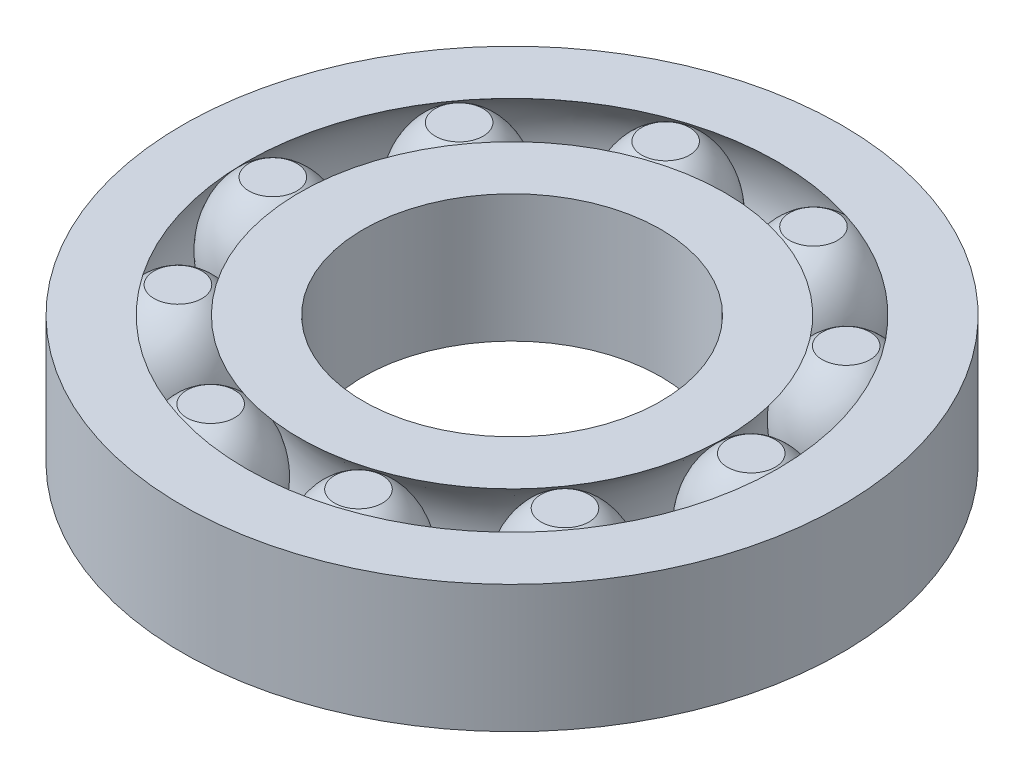
from build123d import *

# Parameters (mm, degrees)
CIRPATTERN7_COUNT = 10


with BuildPart() as part:
    # Sketch1 → Revolve1 (revolve)
    with BuildSketch(Plane.XY):
        with BuildLine():
            Line((-7, 3), (-10, 3))
            add(Edge.make_bspline(
                [(-10, -3), (-5.2, 0), (-10, 3)],
                knots=[3.613454491, 3.613454491, 3.613454491, 5.81132347, 5.81132347, 5.81132347], degree=2, weights=[1, 0.454545455, 1]))
            Line((-10, -3), (-7, -3))
            Line((-7, -3), (-7, 3))
        make_face()
        with BuildLine():
            Line((-15.5, -3), (-12.5, -3))
            add(Edge.make_bspline(
                [(-12.5, 3), (-17.3, 0), (-12.5, -3)],
                knots=[0.471861837, 0.471861837, 0.471861837, 2.669730816, 2.669730816, 2.669730816], degree=2, weights=[1, 0.454545455, 1]))
            Line((-12.5, 3), (-15.5, 3))
            Line((-15.5, 3), (-15.5, -3))
        make_face()
    revolve(axis=Axis((0, 0, 0), (0, 1, 0)))


with BuildPart() as body_2:
    # Sketch3 → Revolve2 (revolve)
    with BuildSketch(Plane.XY):
        with BuildLine():
            Line((-11.25, 3), (-11.25, -3))
            Line((-11.25, -3), (-10.125, -3))
            add(Edge.make_bspline(
                [(-10.125, -3), (-5.125, 0), (-10.125, 3)],
                knots=[3.584503698, 3.584503698, 3.584503698, 5.840274263, 5.840274263, 5.840274263], degree=2, weights=[1, 0.428571429, 1]))
            Line((-10.125, 3), (-11.25, 3))
        make_face()
    revolve(axis=Axis((-11.25, 3, 0), (0, -1, 0)))


with BuildPart() as cirpattern7_1:
    # CirPattern7: pattern copy
    add(body_2.part.rotate(Axis((0, 3, 0), (0, -1, 0)), 1 * 360 / CIRPATTERN7_COUNT))


with BuildPart() as cirpattern7_2:
    # CirPattern7: pattern copy
    add(body_2.part.rotate(Axis((0, 3, 0), (0, -1, 0)), 2 * 360 / CIRPATTERN7_COUNT))


with BuildPart() as cirpattern7_3:
    # CirPattern7: pattern copy
    add(body_2.part.rotate(Axis((0, 3, 0), (0, -1, 0)), 3 * 360 / CIRPATTERN7_COUNT))


with BuildPart() as cirpattern7_4:
    # CirPattern7: pattern copy
    add(body_2.part.rotate(Axis((0, 3, 0), (0, -1, 0)), 4 * 360 / CIRPATTERN7_COUNT))


with BuildPart() as cirpattern7_5:
    # CirPattern7: pattern copy
    add(body_2.part.rotate(Axis((0, 3, 0), (0, -1, 0)), 5 * 360 / CIRPATTERN7_COUNT))


with BuildPart() as cirpattern7_6:
    # CirPattern7: pattern copy
    add(body_2.part.rotate(Axis((0, 3, 0), (0, -1, 0)), 6 * 360 / CIRPATTERN7_COUNT))


with BuildPart() as cirpattern7_7:
    # CirPattern7: pattern copy
    add(body_2.part.rotate(Axis((0, 3, 0), (0, -1, 0)), 7 * 360 / CIRPATTERN7_COUNT))


with BuildPart() as cirpattern7_8:
    # CirPattern7: pattern copy
    add(body_2.part.rotate(Axis((0, 3, 0), (0, -1, 0)), 8 * 360 / CIRPATTERN7_COUNT))


with BuildPart() as cirpattern7_9:
    # CirPattern7: pattern copy
    add(body_2.part.rotate(Axis((0, 3, 0), (0, -1, 0)), 9 * 360 / CIRPATTERN7_COUNT))


solid = Compound([part.part, body_2.part, cirpattern7_1.part, cirpattern7_2.part, cirpattern7_3.part, cirpattern7_4.part, cirpattern7_5.part, cirpattern7_6.part, cirpattern7_7.part, cirpattern7_8.part, cirpattern7_9.part])
